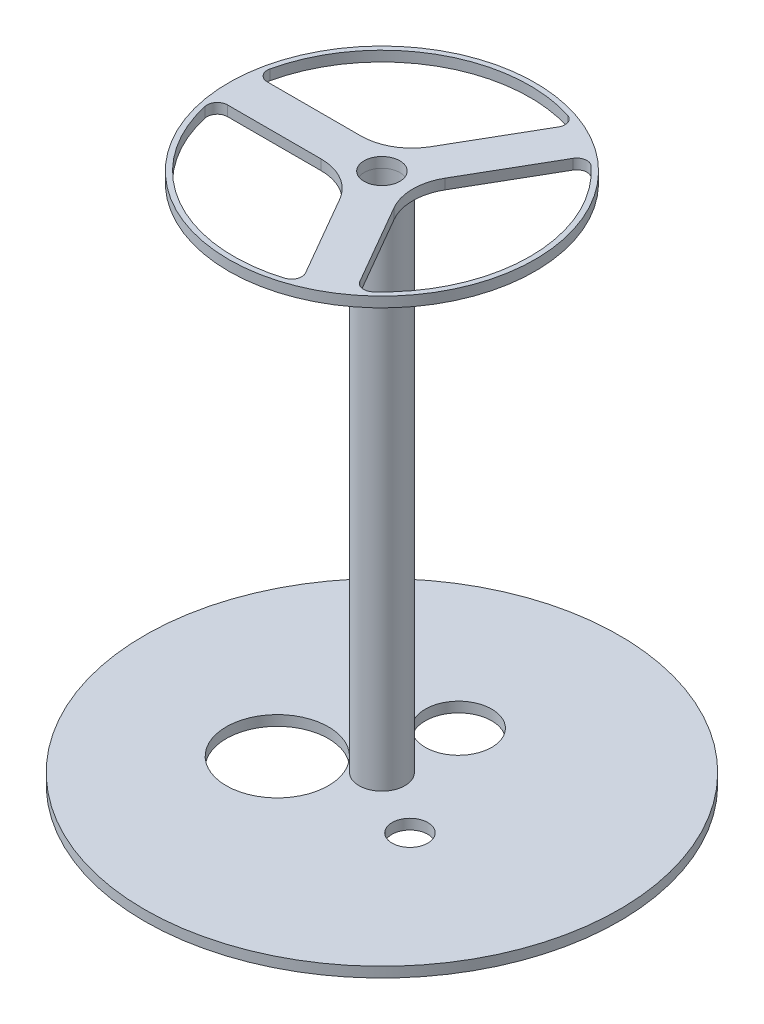
from build123d import *

# Parameters (mm, degrees)
SKETCH1_R           = 46.5
SKETCH1_R_2         = 6.5
SKETCH1_R_3         = 10
SKETCH1_R_4         = 3.5
BOSS_EXTRUDE1_DEPTH = 2
SKETCH3_R           = 4.5
SKETCH3_R_2         = 3.5
BOSS_EXTRUDE2_DEPTH = 100
SKETCH4_R           = 30
SKETCH4_R_2         = 3.5
BOSS_EXTRUDE5_DEPTH = 2
FILLET1_R           = 10
FILLET2_R           = 2
SKETCH5_R           = 1
SKETCH5_R_2         = 3.5
CUT_EXTRUDE1_DEPTH  = 1


with BuildPart() as part:
    # Sketch1 → Boss-Extrude1 (new body)
    with BuildSketch(Plane(origin=(0, 0, 0), x_dir=(1, 0, 0), z_dir=(0, 1, 0))):
        Circle(SKETCH1_R)
        with Locations((0, 15)):
            Circle(SKETCH1_R_2, mode=Mode.SUBTRACT)
        with Locations((-12.990381057, -7.5)):
            Circle(SKETCH1_R_3, mode=Mode.SUBTRACT)
        with Locations((12.990381057, -7.5)):
            Circle(SKETCH1_R_4, mode=Mode.SUBTRACT)
        Circle(SKETCH1_R_4, mode=Mode.SUBTRACT)
    extrude(amount=BOSS_EXTRUDE1_DEPTH)

    # Sketch3 → Boss-Extrude2 (add)
    with BuildSketch(Plane(origin=(0, 2, 0), x_dir=(1, 0, 0), z_dir=(0, 1, 0))):
        Circle(SKETCH3_R)
        Circle(SKETCH3_R_2, mode=Mode.SUBTRACT)
    extrude(amount=BOSS_EXTRUDE2_DEPTH)


with BuildPart() as body_2:
    # Sketch4 → Boss-Extrude5 (new body)
    with BuildSketch(Plane(origin=(0, 102, 0), x_dir=(1, 0, 0), z_dir=(0, 1, 0))):
        Circle(SKETCH4_R)
        with BuildLine():
            Line((-28.736953562, -3.897114317), (-2.25, -3.897114317))
            Line((-2.25, -3.897114317), (10.993476781, -26.83548897))
            ThreePointArc((10.993476781, -26.83548897), (-14.5, -25.11473671), (-28.736953562, -3.897114317))
        make_face(mode=Mode.SUBTRACT)
        Circle(SKETCH4_R_2, mode=Mode.SUBTRACT)
        with BuildLine():
            Line((17.743476781, -22.938374653), (4.5, 0))
            Line((4.5, 0), (17.743476781, 22.938374653))
            ThreePointArc((17.743476781, 22.938374653), (29, 0), (17.743476781, -22.938374653))
        make_face(mode=Mode.SUBTRACT)
        with BuildLine():
            ThreePointArc((-28.736953562, 3.897114317), (-14.5, 25.11473671), (10.993476781, 26.83548897))
            Line((10.993476781, 26.83548897), (-2.25, 3.897114317))
            Line((-2.25, 3.897114317), (-28.736953562, 3.897114317))
        make_face(mode=Mode.SUBTRACT)
    extrude(amount=BOSS_EXTRUDE5_DEPTH)

    # Fillet1
    fillet1_edges = [body_2.edges().sort_by_distance(p)[0] for p in [
        (-2.25, 103, -3.897114317),
        (-2.25, 103, 3.897114317),
        (4.5, 103, 0),
    ]]
    fillet(fillet1_edges, radius=FILLET1_R)

    # Fillet2
    fillet2_edges = [body_2.edges().sort_by_distance(p)[0] for p in [
        (17.743476781, 103, 22.938374653),
        (17.743476781, 103, -22.938374653),
        (10.993476781, 103, -26.83548897),
        (-28.736953562, 103, -3.897114317),
        (-28.736953562, 103, 3.897114317),
        (10.993476781, 103, 26.83548897),
    ]]
    fillet(fillet2_edges, radius=FILLET2_R)

    # Sketch5 → Cut-Extrude1 (cut)
    with BuildSketch(Plane.XZ.offset(-102)):
        with Locations((-15, 0)):
            Circle(SKETCH5_R)
        with Locations((7.5, 12.990381057)):
            Circle(SKETCH5_R_2)
        Polygon((8.383974596, -16.52146997), (4.883974596, -10.459292144), (6.616025404, -9.459292144), (10.116025404, -15.52146997), align=None)
    extrude(amount=-CUT_EXTRUDE1_DEPTH, mode=Mode.SUBTRACT)


solid = Compound([part.part, body_2.part])
